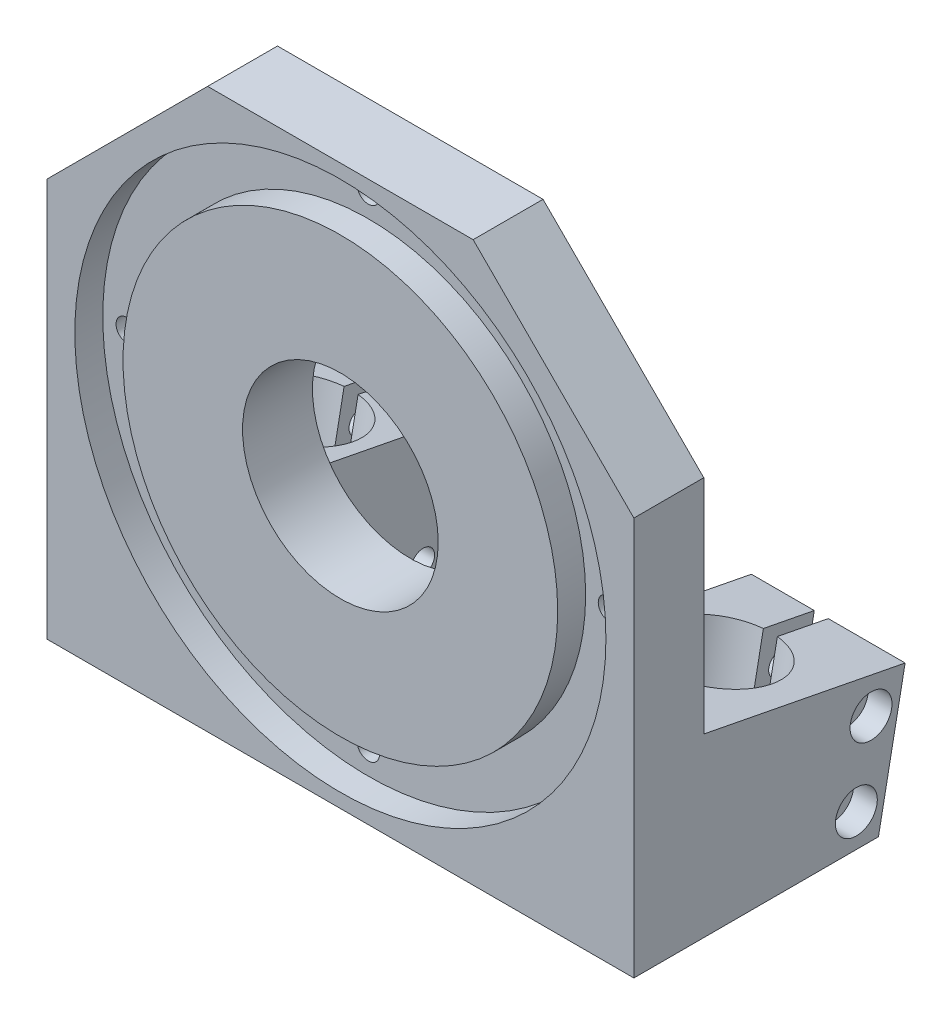
from build123d import *

# Parameters (mm, degrees)
SKETCH_1_W                  = 84
SKETCH_1_H                  = 80
SKETCH_1_R                  = 14
EXTRUDE_1_DEPTH             = 5
EXTRUDE_2_DEPTH             = 22
CUT_EXTRUDE_3_REACH         = 79
HOLE_START                  = -42
HOLE_WIZARD_2_OUTLINE_R     = 1.7
HOLE_WIZARD_2_DEPTH         = 11
HOLE_WIZARD_2_2_OUTLINE_R   = 3
HOLE_WIZARD_2_2_OUTLINE_R_2 = 1.7
HOLE_WIZARD_2_2_DEPTH       = 3.4
HOLE_WIZARD_M4_2_D          = 3.3
SKETCH_14_R                 = 38
SKETCH_14_R_2               = 31.1
CUT_EXTRUDE_4_DEPTH         = 4
HOLE_WIZARD_3_D             = 3.2
HOLE_WIZARD_3_CBORE_D       = 6
HOLE_WIZARD_3_CBORE_DEPTH   = 3.4
CHAMFER_1_SIZE              = 23


# Read off the part's stored shape, not the designer's step: 打孔尺寸(%根据)内六角圆柱头螺钉的类型2
with BuildPart() as part:
    # 草图1 → 凸台-拉伸1 (new, symmetric)
    with BuildSketch(Plane.XY):
        Rectangle(SKETCH_1_W, SKETCH_1_H)
        Circle(SKETCH_1_R, mode=Mode.SUBTRACT)
    extrude(amount=EXTRUDE_1_DEPTH, both=True)

    # 草图6 → 凸台-拉伸2 (add)
    with BuildSketch(Plane.ZY.offset(42)):
        Polygon((-5, -14.766158372), (-5, -40), (-30, -40), (-33.816179908, -20.367456331), align=None)
    extrude_2 = extrude(amount=-EXTRUDE_2_DEPTH)

    # 切除-拉伸3: up to this plane
    cut_extrude_3_end = Plane(origin=(-42, -40, 5), z_dir=(0, 1, 0))
    # 草图7 → 切除-拉伸3 (cut, up to the surface)
    with BuildSketch(Plane(origin=(0, -13.292034521, 2.583709779), x_dir=(1, 0, 0), z_dir=(0, 0.9816271834476648, -0.19080899537654153)), mode=Mode.PRIVATE) as cut_extrude_3_sk1:
        with BuildLine():
            Line((-31, 37.081175318), (-29, 37.081175318))
            Line((-29, 37.081175318), (-29, 29.662905695))
            ThreePointArc((-29, 29.662905695), (-30, 13.725651762), (-31, 29.662905695))
            Line((-31, 29.662905695), (-31, 37.081175318))
        make_face()
    cut_extrude_3_tool1 = split(extrude(cut_extrude_3_sk1.sketch, amount=-CUT_EXTRUDE_3_REACH, mode=Mode.PRIVATE), bisect_by=cut_extrude_3_end, keep=Keep.BOTH, mode=Mode.PRIVATE)
    cut_extrude_3 = cut_extrude_3_tool1.solids().sort_by_distance((-30, -17.589666, -19.525688))[0]
    add(cut_extrude_3, mode=Mode.SUBTRACT)

    # 打孔尺寸(%根据)内六角圆柱头螺钉的类型2 outline → 打孔尺寸(%根据)内六角圆柱头螺钉的类型2 (cut)
    with BuildSketch(Plane.YZ.offset(HOLE_START)):
        with Locations((-35.310255285, -26.836727248)):
            Circle(HOLE_WIZARD_2_OUTLINE_R)
        with Locations((-24.512356267, -28.935626197)):
            Circle(HOLE_WIZARD_2_OUTLINE_R)
    hole_wizard_2 = extrude(amount=HOLE_WIZARD_2_DEPTH, mode=Mode.SUBTRACT)

    # Hole Wizard 2 2 outline → Hole Wizard 2 2 (cut)
    # profile 1 of 2: a face of its own
    with BuildSketch(Plane.YZ.offset(HOLE_START)):
        with Locations((-35.310255285, -26.836727248)):
            Circle(HOLE_WIZARD_2_2_OUTLINE_R)
        with Locations((-35.310255285, -26.836727248)):
            Circle(HOLE_WIZARD_2_2_OUTLINE_R_2, mode=Mode.SUBTRACT)
    # profile 2 of 2: a face of its own
    with BuildSketch(Plane.YZ.offset(HOLE_START)):
        with Locations((-24.512356267, -28.935626197)):
            Circle(HOLE_WIZARD_2_2_OUTLINE_R)
        with Locations((-24.512356267, -28.935626197)):
            Circle(HOLE_WIZARD_2_2_OUTLINE_R_2, mode=Mode.SUBTRACT)
    hole_wizard_2_2 = extrude(amount=HOLE_WIZARD_2_2_DEPTH, mode=Mode.SUBTRACT)

    # M4 螺纹孔2 (through all)
    with Locations(Plane(origin=(-20, 0, 0), x_dir=(0, 0, -1), z_dir=(1, 0, 0))):
        with Locations((28.935626197, -24.512356267), (26.836727248, -35.310255285)):
            hole_wizard_m4_2 = Hole(HOLE_WIZARD_M4_2_D / 2)

    # 草图14 → 切除-拉伸4 (cut)
    with BuildSketch(Plane.XY.offset(5)):
        Circle(SKETCH_14_R)
        Circle(SKETCH_14_R_2, mode=Mode.SUBTRACT)
    extrude(amount=-CUT_EXTRUDE_4_DEPTH, mode=Mode.SUBTRACT)

    # 镜向1: 凸台-拉伸2, 切除-拉伸3, 打孔尺寸(%根据)内六角圆柱头螺钉的类型2, Hole Wizard 2 2, M4 螺纹孔2 across plane
    add(extrude_2.mirror(Plane(origin=(0, 0, 0), x_dir=(0, 0, 1), z_dir=(1, 0, 0))))
    add(cut_extrude_3.mirror(Plane(origin=(0, 0, 0), x_dir=(0, 0, 1), z_dir=(1, 0, 0))), mode=Mode.SUBTRACT)
    add(hole_wizard_2.mirror(Plane(origin=(0, 0, 0), x_dir=(0, 0, 1), z_dir=(1, 0, 0))), mode=Mode.SUBTRACT)
    add(hole_wizard_2_2.mirror(Plane(origin=(0, 0, 0), x_dir=(0, 0, 1), z_dir=(1, 0, 0))), mode=Mode.SUBTRACT)
    add(hole_wizard_m4_2.mirror(Plane(origin=(0, 0, 0), x_dir=(0, 0, 1), z_dir=(1, 0, 0))), mode=Mode.SUBTRACT)

    # 打孔尺寸(%根据)内六角圆柱头螺钉的类型3 (through all)
    with Locations(Plane(origin=(0, 0, -5), x_dir=(-1, 0, 0), z_dir=(0, 0, -1))):
        with Locations((0, 34.5), (34.5, 0), (0, -34.5), (-34.5, 0)):
            CounterBoreHole(HOLE_WIZARD_3_D / 2, HOLE_WIZARD_3_CBORE_D / 2, HOLE_WIZARD_3_CBORE_DEPTH)

    # 倒角1
    chamfer_1_edges = [part.edges().sort_by_distance(p)[0] for p in [
        (42, 40, 0),
        (-42, 40, 0),
    ]]
    chamfer(chamfer_1_edges, length=CHAMFER_1_SIZE)


solid = part.part
